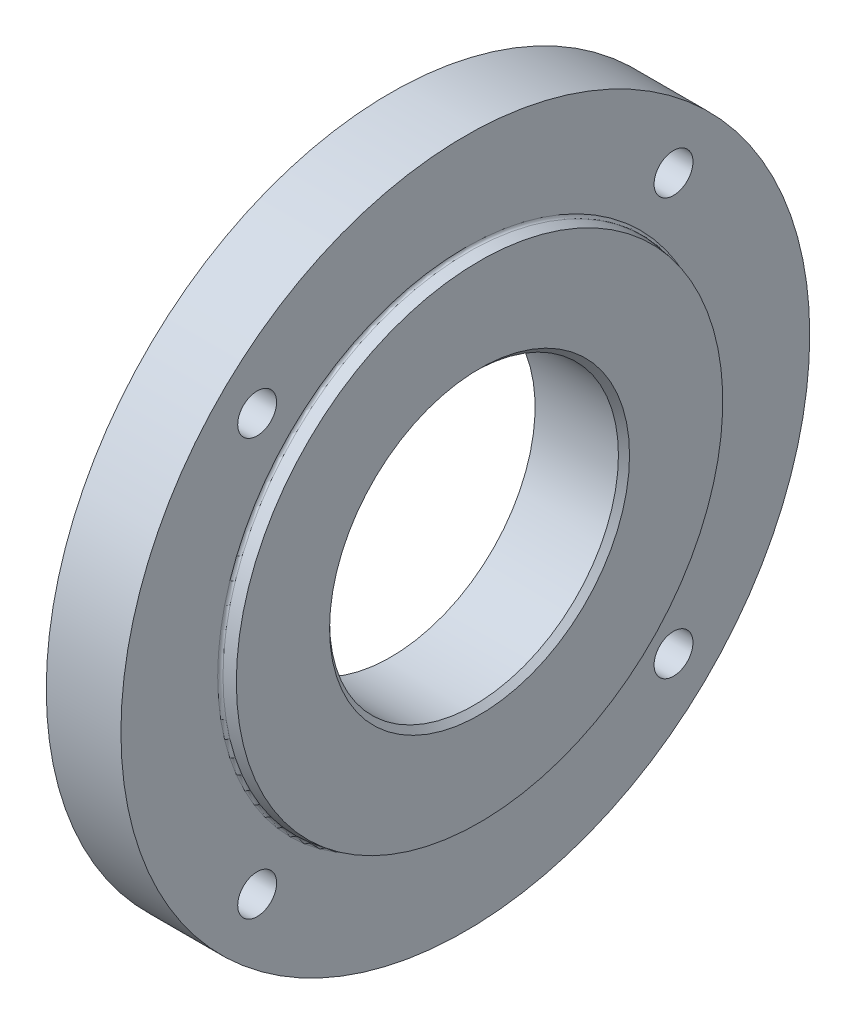
from build123d import *

# Parameters (mm, degrees)
SKETCH2_R          = 5.55625
CUT_EXTRUDE1_DEPTH = 141.819693743
CIRPATTERN1_COUNT  = 4
CHAMFER1_SIZE      = 0.508
CHAMFER1_SIZE2     = 3.302
CHAMFER2_SIZE      = 1.5875
FILLET1_R          = 0.762


with BuildPart() as part:
    # Sketch1 → Revolve1 (revolve)
    with BuildSketch(Plane.XY, mode=Mode.PRIVATE) as revolve1_sk:
        Polygon((0, 41.275), (0, 98.425), (21.336, 98.425), (21.336, 70.0151), (25.4, 70.0151), (25.4, 41.275), align=None)
    revolve(revolve1_sk.sketch.rotate(Axis((0, 0, 0), (1, 0, 0)), 90), axis=Axis((0, 0, 0), (1, 0, 0)))

    # Sketch2 → Cut-Extrude1 (cut, through all)
    with BuildSketch(Plane(origin=(21.336, 0, 0), x_dir=(0, 0, -1), z_dir=(1, 0, 0))):
        with Locations((59.494196802, 59.494196802)):
            Circle(SKETCH2_R)
    cut_extrude1 = extrude(amount=-CUT_EXTRUDE1_DEPTH, mode=Mode.SUBTRACT)

    # CirPattern1: Cut-Extrude1 ×4 about axis
    cirpattern1_axis = Axis((0, 0, 0), (1, 0, 0))
    for i in range(1, CIRPATTERN1_COUNT):
        add(cut_extrude1.rotate(cirpattern1_axis, i * 360 / CIRPATTERN1_COUNT), mode=Mode.SUBTRACT)

    # Chamfer1
    chamfer1_edges = [part.edges().sort_by_distance(p)[0] for p in [
        (25.4, 0, -70.0151),
    ]]
    chamfer1_side = [part.faces().sort_by_distance(p)[0] for p in [
        (25.4, 0, -68.03477392),
    ]]
    chamfer(chamfer1_edges, length=CHAMFER1_SIZE, length2=CHAMFER1_SIZE2, reference=chamfer1_side[0])

    # Chamfer2
    chamfer2_edges = [part.edges().sort_by_distance(p)[0] for p in [
        (25.4, 0, -41.275),
    ]]
    chamfer(chamfer2_edges, length=CHAMFER2_SIZE)

    # Fillet1
    fillet1_edges = [part.edges().sort_by_distance(p)[0] for p in [
        (21.336, 0, -70.0151),
    ]]
    fillet(fillet1_edges, radius=FILLET1_R - 0.0001)  # a hair under: the kernel refuses the full size


solid = part.part
